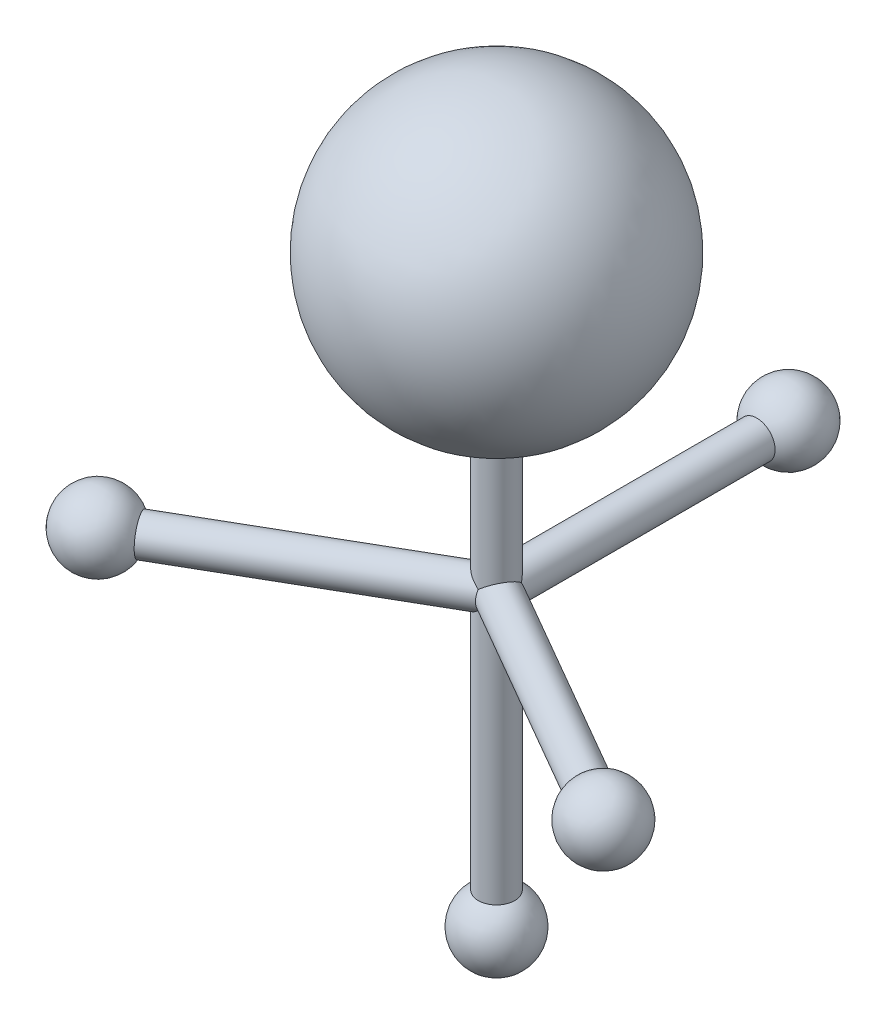
from build123d import *

# Parameters (mm, degrees)
SKETCH_1_W                 = 2.5
SKETCH_1_H                 = 40
PATTERN_CIRCULAR_853_COUNT = 3
PATTERN_CIRCULAR_912_COUNT = 3
EXTRUDE_2_DEPTH            = 40
EXTRUDE_2_DEPTH_BACK       = 40
SKETCH_5_R                 = 2.5


with BuildPart() as part:
    # 草图1 → Revolve 1 (revolve)
    with BuildSketch(Plane(origin=(0, 0, 0), x_dir=(1, 0, 0), z_dir=(0, 1, 0))):
        with Locations((-1.25, 20)):
            Rectangle(SKETCH_1_W, SKETCH_1_H)
    revolve_1 = revolve(axis=Axis((0, 0, 0), (0, 0, -1)))

    # 草图4 → Revolve 1 2 (revolve)
    with BuildSketch(Plane(origin=(0, 0, -40), x_dir=(-1, 0, 0), z_dir=(0, 0, -1))):
        with BuildLine():
            ThreePointArc((0, -5), (5, 0), (0, 5))
            Line((0, 5), (0, -5))
        make_face()
    revolve_1_2 = revolve(axis=Axis((0, -1000, -40), (0, 1, 0)))

    # Pattern Circular 853: Revolve 1 ×3 about axis
    pattern_circular_853_axis = Axis((0, -1000, 0), (0, 1, 0))
    for i in range(1, PATTERN_CIRCULAR_853_COUNT):
        add(revolve_1.rotate(pattern_circular_853_axis, i * 360 / PATTERN_CIRCULAR_853_COUNT))

    # Pattern Circular 912: Revolve 1 2 ×3 about axis
    pattern_circular_912_axis = Axis((0, -1000, 0), (0, 1, 0))
    for i in range(1, PATTERN_CIRCULAR_912_COUNT):
        add(revolve_1_2.rotate(pattern_circular_912_axis, i * 360 / PATTERN_CIRCULAR_912_COUNT))

    # 草图5 → 杆件2 (add, two sides: drawn at the far end of the back side and taken through both)
    with BuildSketch(Plane(origin=(0, 0, 0), x_dir=(1, 0, 0), z_dir=(0, 1, 0)).offset(-EXTRUDE_2_DEPTH_BACK)):
        Circle(SKETCH_5_R)
    extrude(amount=EXTRUDE_2_DEPTH + EXTRUDE_2_DEPTH_BACK)

    # 草图6 → 标记点2 (revolve)
    with BuildSketch(Plane.XZ.offset(40)):
        with BuildLine():
            ThreePointArc((0, 5), (-5, 0), (0, -5))
            Line((0, -5), (0, 5))
        make_face()
    revolve(axis=Axis((0, -40, -1000), (0, 0, 1)))

    # 草图7 → 旋转4 (revolve)
    with BuildSketch(Plane(origin=(0, 40, 0), x_dir=(1, 0, 0), z_dir=(0, 1, 0))):
        with BuildLine():
            ThreePointArc((0, -20), (20, 0), (0, 20))
            Line((0, 20), (0, -20))
        make_face()
    revolve(axis=Axis((0, 40, 1000), (0, 0, -1)))


solid = part.part
